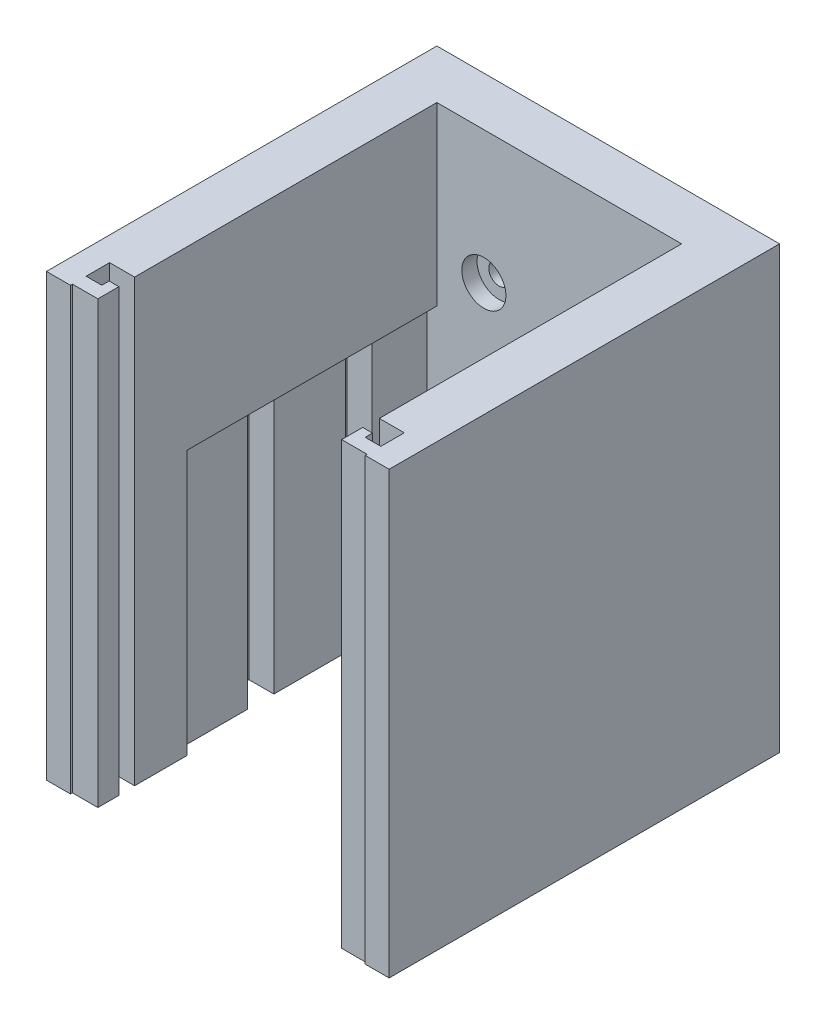
from build123d import *

# Parameters (mm, degrees)
SKETCH1_W                                     = 90
SKETCH1_H                                     = 70
BOSS_EXTRUDE1_DEPTH                           = 10
SKETCH2_W                                     = 8
SKETCH2_H                                     = 90
BOSS_EXTRUDE2_DEPTH                           = 51
SKETCH3_W                                     = 5.1
SKETCH3_H                                     = 5.4
CUT_EXTRUDE1_DEPTH                            = 54
SKETCH14_W                                    = 10
SKETCH14_H                                    = 90
BOSS_EXTRUDE6_DEPTH                           = 11.75
SKETCH15_W                                    = 4.9
SKETCH15_H                                    = 90
BOSS_EXTRUDE7_DEPTH                           = 7
SKETCH17_W                                    = 90
SKETCH17_H                                    = 2.8
BOSS_EXTRUDE8_DEPTH                           = 5
SKETCH16_W                                    = 5.1
SKETCH16_H                                    = 90
CUT_EXTRUDE3_DEPTH                            = 1
BOSS_EXTRUDE9_START                           = -1.5
SKETCH18_W                                    = 2
SKETCH18_H                                    = 90
BOSS_EXTRUDE9_DEPTH                           = 4.3
SKETCH43_W                                    = 36
SKETCH43_H                                    = 51
BOSS_EXTRUDE10_DEPTH                          = 2
SKETCH21_R                                    = 2.1
CUT_EXTRUDE7_DEPTH                            = 99.030926243
CBORE_FOR_M4_PAN_HEAD_MACHINE_SCREW4_AT_COUNT = 2
CBORE_FOR_M4_PAN_HEAD_MACHINE_SCREW4_AT_PITCH = 33.407334524
ADVANCEDHOLE1_START                           = 6.9
ADVANCEDHOLE1_OUTLINE_R                       = 4.5
ADVANCEDHOLE1_OUTLINE_R_2                     = 2.1
ADVANCEDHOLE1_DEPTH                           = 3.1


# Read off the part's stored shape, not the designer's step: AdvancedHole1
with BuildPart() as part:
    # Sketch1 → Boss-Extrude1 (new body)
    with BuildSketch(Plane(origin=(0, 0, 0), x_dir=(0, 1, 0), z_dir=(0, 0, 1))):
        Rectangle(SKETCH1_W, SKETCH1_H)
    extrude(amount=BOSS_EXTRUDE1_DEPTH)

    # Sketch2 → Boss-Extrude2 (add)
    with BuildSketch(Plane.XY.offset(10)):
        with Locations((-31, 0)):
            Rectangle(SKETCH2_W, SKETCH2_H)
        with Locations((31, 0)):
            Rectangle(SKETCH2_W, SKETCH2_H)
    extrude(amount=BOSS_EXTRUDE2_DEPTH)

    # Sketch3 → Cut-Extrude1 (cut)
    with BuildSketch(Plane.XZ.offset(45)):
        with Locations((-29.55, 24)):
            Rectangle(SKETCH3_W, SKETCH3_H)
        with Locations((-29.55, 44)):
            Rectangle(SKETCH3_W, SKETCH3_H)
        with Locations((29.55, 24)):
            Rectangle(SKETCH3_W, SKETCH3_H)
        with Locations((29.55, 44)):
            Rectangle(SKETCH3_W, SKETCH3_H)
    extrude(amount=-CUT_EXTRUDE1_DEPTH, mode=Mode.SUBTRACT)

    # Sketch14 → Boss-Extrude6 (add)
    with BuildSketch(Plane.XY.offset(61)):
        with Locations((30, 0)):
            Rectangle(SKETCH14_W, SKETCH14_H)
    boss_extrude6 = extrude(amount=BOSS_EXTRUDE6_DEPTH)

    # Sketch15 → Boss-Extrude7 (add)
    with BuildSketch(Plane.XY.offset(72.75)):
        with Locations((32.55, 0)):
            Rectangle(SKETCH15_W, SKETCH15_H)
    boss_extrude7 = extrude(amount=BOSS_EXTRUDE7_DEPTH)

    # Sketch17 → Boss-Extrude8 (add)
    with BuildSketch(Plane(origin=(30.1, 0, 0), x_dir=(0, -1, 0), z_dir=(-1, 0, 0))):
        with Locations((0, 77.95)):
            Rectangle(SKETCH17_W, SKETCH17_H)
    boss_extrude8 = extrude(amount=BOSS_EXTRUDE8_DEPTH)

    # Sketch16 → Cut-Extrude3 (cut)
    with BuildSketch(Plane.XY.offset(72.75)):
        with Locations((27.55, 0)):
            Rectangle(SKETCH16_W, SKETCH16_H)
    cut_extrude3 = extrude(amount=-CUT_EXTRUDE3_DEPTH, mode=Mode.SUBTRACT)

    # Sketch18 → Boss-Extrude9 (add)
    with BuildSketch(Plane.XY.offset(76.55).offset(BOSS_EXTRUDE9_START)):
        with Locations((25.9, 0)):
            Rectangle(SKETCH18_W, SKETCH18_H)
    boss_extrude9 = extrude(amount=BOSS_EXTRUDE9_DEPTH)

    # Sketch43 → Boss-Extrude10 (add)
    with BuildSketch(Plane(origin=(27, 0, 0), x_dir=(0, -1, 0), z_dir=(-1, 0, 0))):
        with Locations((-27, 35.5)):
            Rectangle(SKETCH43_W, SKETCH43_H)
    boss_extrude10 = extrude(amount=BOSS_EXTRUDE10_DEPTH)

    # Mirror2: Boss-Extrude6, Boss-Extrude7, Boss-Extrude8, Cut-Extrude3, Boss-Extrude9, Boss-Extrude10 across plane
    add(boss_extrude6.mirror(Plane(origin=(0, 0, 0), x_dir=(0, 0, 1), z_dir=(1, 0, 0))))
    add(boss_extrude7.mirror(Plane(origin=(0, 0, 0), x_dir=(0, 0, 1), z_dir=(1, 0, 0))))
    add(boss_extrude8.mirror(Plane(origin=(0, 0, 0), x_dir=(0, 0, 1), z_dir=(1, 0, 0))))
    add(cut_extrude3.mirror(Plane(origin=(0, 0, 0), x_dir=(0, 0, 1), z_dir=(1, 0, 0))), mode=Mode.SUBTRACT)
    add(boss_extrude9.mirror(Plane(origin=(0, 0, 0), x_dir=(0, 0, 1), z_dir=(1, 0, 0))))
    add(boss_extrude10.mirror(Plane(origin=(0, 0, 0), x_dir=(0, 0, 1), z_dir=(1, 0, 0))))

    # Sketch21 → Cut-Extrude7 (cut, through all)
    with BuildSketch(Plane(origin=(0, 0, 0), x_dir=(1, 0, 0), z_dir=(0, 0, -1))):
        with Locations((17.5, 12.1)):
            Circle(SKETCH21_R)
        with Locations(Location((17.5, -12.1, 0), (0, 0, 180))):
            Circle(SKETCH21_R)
        with Locations(Location((-15.4, -17.9, 0), (0, 0, 180))):
            Circle(SKETCH21_R)
        with Locations((-15.4, 17.9)):
            Circle(SKETCH21_R)
    extrude(amount=-CUT_EXTRUDE7_DEPTH, mode=Mode.SUBTRACT)

    # Sketch30 → CBORE for M4 Pan Head Machine Screw4 (revolve, cut)
    with BuildSketch(Plane(origin=(17.5, -12.1, 10), x_dir=(0, -1, 0), z_dir=(1, 0, 0))):
        Polygon((0, 0), (0, 10), (2.25, 10), (2.25, 3.1), (4.5, 3.1), (4.5, 0.025), (4.525, 0), align=None)
    cbore_for_m4_pan_head_machine_screw4 = revolve(axis=Axis((17.5, -12.1, 16.35), (0, 0, -1)), mode=Mode.SUBTRACT)

    # CBORE for M4 Pan Head Machine Screw4 at: CBORE for M4 Pan Head Machine Screw4 ×2
    with Locations(*[Vector(-0.9848136784555953, -0.1736145694541778, 0) * (i * CBORE_FOR_M4_PAN_HEAD_MACHINE_SCREW4_AT_PITCH) for i in range(1, CBORE_FOR_M4_PAN_HEAD_MACHINE_SCREW4_AT_COUNT)]):
        add(cbore_for_m4_pan_head_machine_screw4, mode=Mode.SUBTRACT)

    # AdvancedHole1 outline → AdvancedHole1 (cut)
    # profile 1 of 2: a face of its own
    with BuildSketch(Plane.XY.offset(ADVANCEDHOLE1_START)):
        with Locations((17.5, 12.1)):
            Circle(ADVANCEDHOLE1_OUTLINE_R)
        with Locations((17.5, 12.1)):
            Circle(ADVANCEDHOLE1_OUTLINE_R_2, mode=Mode.SUBTRACT)
    # profile 2 of 2: a face of its own
    with BuildSketch(Plane.XY.offset(ADVANCEDHOLE1_START)):
        with Locations((-15.4, 17.9)):
            Circle(ADVANCEDHOLE1_OUTLINE_R)
        with Locations((-15.4, 17.9)):
            Circle(ADVANCEDHOLE1_OUTLINE_R_2, mode=Mode.SUBTRACT)
    extrude(amount=ADVANCEDHOLE1_DEPTH, mode=Mode.SUBTRACT)


solid = part.part
